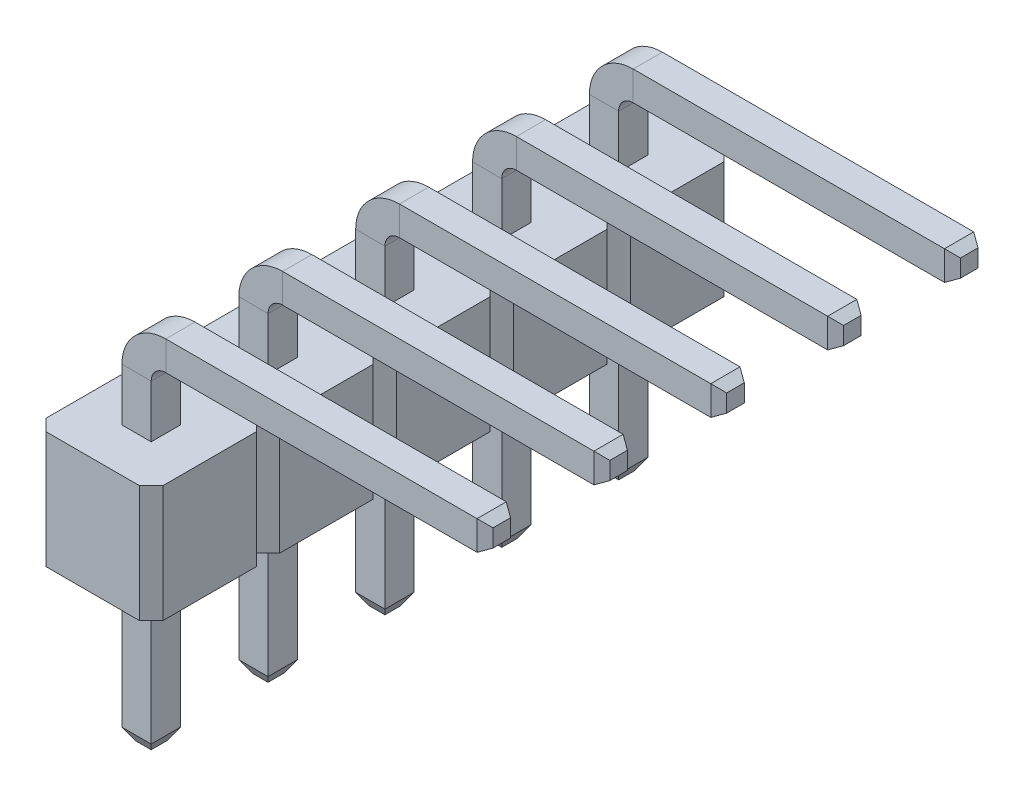
from build123d import *
from OCP.BRepFilletAPI import BRepFilletAPI_MakeChamfer

# Parameters (mm, degrees)
BOSS_EXTRUDE1_DEPTH          = 2.54
SKETCH3_W                    = 0.635
SKETCH3_H                    = 0.635
CHAMFER1_SIZE                = 0.254
CHAMFER1_SIZE2               = 0.146646968
CHAMFER2_SIZE                = 0.219970453
CHAMFER2_SIZE_2              = 0.127
LPATTERN1_COUNT              = 5
LPATTERN1_PITCH              = 2.54
CHAMFER1_OF_LPATTERN1_SIZE   = 0.254
CHAMFER1_OF_LPATTERN1_SIZE2  = 0.146646968
CHAMFER2_OF_LPATTERN1_SIZE   = 0.219970453
CHAMFER2_OF_LPATTERN1_SIZE_2 = 0.127


with BuildPart() as part:
    # Sketch1 → Boss-Extrude1 (new body)
    with BuildSketch(Plane(origin=(0, 0, 0), x_dir=(1, 0, 0), z_dir=(0, 1, 0))):
        Polygon((1.016, 1.27), (1.27, 1.016), (1.27, -1.016), (1.016, -1.27), (-1.016, -1.27), (-1.27, -1.016), (-1.27, 1.016), (-1.016, 1.27), align=None)
    boss_extrude1 = extrude(amount=BOSS_EXTRUDE1_DEPTH)

    # Sweep1: sweep along a path in Sketch2
    with BuildLine(Plane.XY) as sweep1_path:
        Line((0, -3.4036), (0, 0))
        Line((0, 0), (0, 3.683))
        ThreePointArc((0, 3.683), (0.185987194, 4.132012806), (0.635, 4.318))
        Line((0.635, 4.318), (7.62, 4.318))
    # Sketch3 → Sweep1 (sweep)
    with BuildSketch(Plane(origin=(0, -3.4036, 0), x_dir=(-1, 0, 0), z_dir=(0, -1, 0))):
        Rectangle(SKETCH3_W, SKETCH3_H)
    sweep1 = sweep(path=sweep1_path.line)

    # Chamfer1: one chamfer whose edges measure the first distance from different faces: ONE call of the kernel's chamfer builder (chamfer() names one face for all edges)
    chamfer1_edges_1 = [part.edges().sort_by_distance(p)[0] for p in [
        (0.3175, -3.4036, 0),
    ]]
    chamfer1_side_1 = [part.faces().sort_by_distance(p)[0] for p in [
        (0.3175, -1.7018, 0),
    ]]
    chamfer1_edges_2 = [part.edges().sort_by_distance(p)[0] for p in [
        (0, -3.4036, 0.3175),
    ]]
    chamfer1_side_2 = [part.faces().sort_by_distance(p)[0] for p in [
        (0, -1.7018, 0.3175),
    ]]
    chamfer1_edges_3 = [part.edges().sort_by_distance(p)[0] for p in [
        (-0.3175, -3.4036, 0),
    ]]
    chamfer1_side_3 = [part.faces().sort_by_distance(p)[0] for p in [
        (-0.3175, -1.7018, 0),
    ]]
    chamfer1_edges_4 = [part.edges().sort_by_distance(p)[0] for p in [
        (0, -3.4036, -0.3175),
    ]]
    chamfer1_side_4 = [part.faces().sort_by_distance(p)[0] for p in [
        (0, -1.7018, -0.3175),
    ]]
    chamfer1 = BRepFilletAPI_MakeChamfer(part.part.solid().wrapped)
    for e in chamfer1_edges_1:
        chamfer1.Add(CHAMFER1_SIZE, CHAMFER1_SIZE2, e.wrapped, chamfer1_side_1[0].wrapped)  # the first distance lies on this face
    for e in chamfer1_edges_2:
        chamfer1.Add(CHAMFER1_SIZE, CHAMFER1_SIZE2, e.wrapped, chamfer1_side_2[0].wrapped)  # the first distance lies on this face
    for e in chamfer1_edges_3:
        chamfer1.Add(CHAMFER1_SIZE, CHAMFER1_SIZE2, e.wrapped, chamfer1_side_3[0].wrapped)  # the first distance lies on this face
    for e in chamfer1_edges_4:
        chamfer1.Add(CHAMFER1_SIZE, CHAMFER1_SIZE2, e.wrapped, chamfer1_side_4[0].wrapped)  # the first distance lies on this face
    add(Compound.cast(chamfer1.Shape()), mode=Mode.REPLACE)

    # Chamfer2
    chamfer2_edges_1 = [part.edges().sort_by_distance(p)[0] for p in [
        (7.62, 4.0005, 0),
    ]]
    chamfer2_side_1 = [part.faces().sort_by_distance(p)[0] for p in [
        (7.61746, 4.0005, 0),
    ]]
    chamfer2_edges_2 = [part.edges().sort_by_distance(p)[0] for p in [
        (7.62, 4.318, 0.3175),
    ]]
    chamfer2_side_2 = [part.faces().sort_by_distance(p)[0] for p in [
        (7.61746, 4.318, 0.3175),
    ]]
    chamfer2_edges_3 = [part.edges().sort_by_distance(p)[0] for p in [
        (7.62, 4.6355, 0),
    ]]
    chamfer2_side_3 = [part.faces().sort_by_distance(p)[0] for p in [
        (7.62, 4.63296, 0),
    ]]
    chamfer2_edges_4 = [part.edges().sort_by_distance(p)[0] for p in [
        (7.62, 4.318, -0.3175),
    ]]
    chamfer2_side_4 = [part.faces().sort_by_distance(p)[0] for p in [
        (7.61746, 4.318, -0.3175),
    ]]
    chamfer2 = BRepFilletAPI_MakeChamfer(part.part.solid().wrapped)
    for e in chamfer2_edges_1:
        chamfer2.Add(CHAMFER2_SIZE - 0.0001, CHAMFER2_SIZE_2 - 0.0001, e.wrapped, chamfer2_side_1[0].wrapped)
    for e in chamfer2_edges_2:
        chamfer2.Add(CHAMFER2_SIZE - 0.0001, CHAMFER2_SIZE_2 - 0.0001, e.wrapped, chamfer2_side_2[0].wrapped)
    for e in chamfer2_edges_3:
        chamfer2.Add(CHAMFER2_SIZE_2 - 0.0001, CHAMFER2_SIZE - 0.0001, e.wrapped, chamfer2_side_3[0].wrapped)
    for e in chamfer2_edges_4:
        chamfer2.Add(CHAMFER2_SIZE - 0.0001, CHAMFER2_SIZE_2 - 0.0001, e.wrapped, chamfer2_side_4[0].wrapped)
    add(Compound.cast(chamfer2.Shape()), mode=Mode.REPLACE)  # a hair under: the kernel refuses the full size

    # LPattern1: Boss-Extrude1, Sweep1 ×5
    with Locations(*[(0, 0, i * LPATTERN1_PITCH) for i in range(1, LPATTERN1_COUNT)]):
        add(boss_extrude1)
        add(sweep1)

    # Chamfer1 of LPattern1: one chamfer whose edges measure the first distance from different faces: ONE call of the kernel's chamfer builder (chamfer() names one face for all edges)
    chamfer1_of_lpattern1_edges_1 = [part.edges().sort_by_distance(p)[0] for p in [
        (0.3175, -3.4036, 2.54),
    ]]
    chamfer1_of_lpattern1_side_1 = [part.faces().sort_by_distance(p)[0] for p in [
        (0.3175, -1.7018, 2.54),
    ]]
    chamfer1_of_lpattern1_edges_2 = [part.edges().sort_by_distance(p)[0] for p in [
        (0, -3.4036, 2.8575),
    ]]
    chamfer1_of_lpattern1_side_2 = [part.faces().sort_by_distance(p)[0] for p in [
        (0, -1.7018, 2.8575),
    ]]
    chamfer1_of_lpattern1_edges_3 = [part.edges().sort_by_distance(p)[0] for p in [
        (-0.3175, -3.4036, 2.54),
    ]]
    chamfer1_of_lpattern1_side_3 = [part.faces().sort_by_distance(p)[0] for p in [
        (-0.3175, -1.7018, 2.54),
    ]]
    chamfer1_of_lpattern1_edges_4 = [part.edges().sort_by_distance(p)[0] for p in [
        (0, -3.4036, 2.2225),
    ]]
    chamfer1_of_lpattern1_side_4 = [part.faces().sort_by_distance(p)[0] for p in [
        (0, -1.7018, 2.2225),
    ]]
    chamfer1_of_lpattern1_edges_5 = [part.edges().sort_by_distance(p)[0] for p in [
        (0.3175, -3.4036, 5.08),
    ]]
    chamfer1_of_lpattern1_side_5 = [part.faces().sort_by_distance(p)[0] for p in [
        (0.3175, -1.7018, 5.08),
    ]]
    chamfer1_of_lpattern1_edges_6 = [part.edges().sort_by_distance(p)[0] for p in [
        (0, -3.4036, 5.3975),
    ]]
    chamfer1_of_lpattern1_side_6 = [part.faces().sort_by_distance(p)[0] for p in [
        (0, -1.7018, 5.3975),
    ]]
    chamfer1_of_lpattern1_edges_7 = [part.edges().sort_by_distance(p)[0] for p in [
        (-0.3175, -3.4036, 5.08),
    ]]
    chamfer1_of_lpattern1_side_7 = [part.faces().sort_by_distance(p)[0] for p in [
        (-0.3175, -1.7018, 5.08),
    ]]
    chamfer1_of_lpattern1_edges_8 = [part.edges().sort_by_distance(p)[0] for p in [
        (0, -3.4036, 4.7625),
    ]]
    chamfer1_of_lpattern1_side_8 = [part.faces().sort_by_distance(p)[0] for p in [
        (0, -1.7018, 4.7625),
    ]]
    chamfer1_of_lpattern1_edges_9 = [part.edges().sort_by_distance(p)[0] for p in [
        (0.3175, -3.4036, 7.62),
    ]]
    chamfer1_of_lpattern1_side_9 = [part.faces().sort_by_distance(p)[0] for p in [
        (0.3175, -1.7018, 7.62),
    ]]
    chamfer1_of_lpattern1_edges_10 = [part.edges().sort_by_distance(p)[0] for p in [
        (0, -3.4036, 7.9375),
    ]]
    chamfer1_of_lpattern1_side_10 = [part.faces().sort_by_distance(p)[0] for p in [
        (0, -1.7018, 7.9375),
    ]]
    chamfer1_of_lpattern1_edges_11 = [part.edges().sort_by_distance(p)[0] for p in [
        (-0.3175, -3.4036, 7.62),
    ]]
    chamfer1_of_lpattern1_side_11 = [part.faces().sort_by_distance(p)[0] for p in [
        (-0.3175, -1.7018, 7.62),
    ]]
    chamfer1_of_lpattern1_edges_12 = [part.edges().sort_by_distance(p)[0] for p in [
        (0, -3.4036, 7.3025),
    ]]
    chamfer1_of_lpattern1_side_12 = [part.faces().sort_by_distance(p)[0] for p in [
        (0, -1.7018, 7.3025),
    ]]
    chamfer1_of_lpattern1_edges_13 = [part.edges().sort_by_distance(p)[0] for p in [
        (0.3175, -3.4036, 10.16),
    ]]
    chamfer1_of_lpattern1_side_13 = [part.faces().sort_by_distance(p)[0] for p in [
        (0.3175, -1.7018, 10.16),
    ]]
    chamfer1_of_lpattern1_edges_14 = [part.edges().sort_by_distance(p)[0] for p in [
        (0, -3.4036, 10.4775),
    ]]
    chamfer1_of_lpattern1_side_14 = [part.faces().sort_by_distance(p)[0] for p in [
        (0, -1.7018, 10.4775),
    ]]
    chamfer1_of_lpattern1_edges_15 = [part.edges().sort_by_distance(p)[0] for p in [
        (-0.3175, -3.4036, 10.16),
    ]]
    chamfer1_of_lpattern1_side_15 = [part.faces().sort_by_distance(p)[0] for p in [
        (-0.3175, -1.7018, 10.16),
    ]]
    chamfer1_of_lpattern1_edges_16 = [part.edges().sort_by_distance(p)[0] for p in [
        (0, -3.4036, 9.8425),
    ]]
    chamfer1_of_lpattern1_side_16 = [part.faces().sort_by_distance(p)[0] for p in [
        (0, -1.7018, 9.8425),
    ]]
    chamfer1_of_lpattern1 = BRepFilletAPI_MakeChamfer(part.part.solid().wrapped)
    for e in chamfer1_of_lpattern1_edges_1:
        chamfer1_of_lpattern1.Add(CHAMFER1_OF_LPATTERN1_SIZE, CHAMFER1_OF_LPATTERN1_SIZE2, e.wrapped, chamfer1_of_lpattern1_side_1[0].wrapped)  # the first distance lies on this face
    for e in chamfer1_of_lpattern1_edges_2:
        chamfer1_of_lpattern1.Add(CHAMFER1_OF_LPATTERN1_SIZE, CHAMFER1_OF_LPATTERN1_SIZE2, e.wrapped, chamfer1_of_lpattern1_side_2[0].wrapped)  # the first distance lies on this face
    for e in chamfer1_of_lpattern1_edges_3:
        chamfer1_of_lpattern1.Add(CHAMFER1_OF_LPATTERN1_SIZE, CHAMFER1_OF_LPATTERN1_SIZE2, e.wrapped, chamfer1_of_lpattern1_side_3[0].wrapped)  # the first distance lies on this face
    for e in chamfer1_of_lpattern1_edges_4:
        chamfer1_of_lpattern1.Add(CHAMFER1_OF_LPATTERN1_SIZE, CHAMFER1_OF_LPATTERN1_SIZE2, e.wrapped, chamfer1_of_lpattern1_side_4[0].wrapped)  # the first distance lies on this face
    for e in chamfer1_of_lpattern1_edges_5:
        chamfer1_of_lpattern1.Add(CHAMFER1_OF_LPATTERN1_SIZE, CHAMFER1_OF_LPATTERN1_SIZE2, e.wrapped, chamfer1_of_lpattern1_side_5[0].wrapped)  # the first distance lies on this face
    for e in chamfer1_of_lpattern1_edges_6:
        chamfer1_of_lpattern1.Add(CHAMFER1_OF_LPATTERN1_SIZE, CHAMFER1_OF_LPATTERN1_SIZE2, e.wrapped, chamfer1_of_lpattern1_side_6[0].wrapped)  # the first distance lies on this face
    for e in chamfer1_of_lpattern1_edges_7:
        chamfer1_of_lpattern1.Add(CHAMFER1_OF_LPATTERN1_SIZE, CHAMFER1_OF_LPATTERN1_SIZE2, e.wrapped, chamfer1_of_lpattern1_side_7[0].wrapped)  # the first distance lies on this face
    for e in chamfer1_of_lpattern1_edges_8:
        chamfer1_of_lpattern1.Add(CHAMFER1_OF_LPATTERN1_SIZE, CHAMFER1_OF_LPATTERN1_SIZE2, e.wrapped, chamfer1_of_lpattern1_side_8[0].wrapped)  # the first distance lies on this face
    for e in chamfer1_of_lpattern1_edges_9:
        chamfer1_of_lpattern1.Add(CHAMFER1_OF_LPATTERN1_SIZE, CHAMFER1_OF_LPATTERN1_SIZE2, e.wrapped, chamfer1_of_lpattern1_side_9[0].wrapped)  # the first distance lies on this face
    for e in chamfer1_of_lpattern1_edges_10:
        chamfer1_of_lpattern1.Add(CHAMFER1_OF_LPATTERN1_SIZE, CHAMFER1_OF_LPATTERN1_SIZE2, e.wrapped, chamfer1_of_lpattern1_side_10[0].wrapped)  # the first distance lies on this face
    for e in chamfer1_of_lpattern1_edges_11:
        chamfer1_of_lpattern1.Add(CHAMFER1_OF_LPATTERN1_SIZE, CHAMFER1_OF_LPATTERN1_SIZE2, e.wrapped, chamfer1_of_lpattern1_side_11[0].wrapped)  # the first distance lies on this face
    for e in chamfer1_of_lpattern1_edges_12:
        chamfer1_of_lpattern1.Add(CHAMFER1_OF_LPATTERN1_SIZE, CHAMFER1_OF_LPATTERN1_SIZE2, e.wrapped, chamfer1_of_lpattern1_side_12[0].wrapped)  # the first distance lies on this face
    for e in chamfer1_of_lpattern1_edges_13:
        chamfer1_of_lpattern1.Add(CHAMFER1_OF_LPATTERN1_SIZE, CHAMFER1_OF_LPATTERN1_SIZE2, e.wrapped, chamfer1_of_lpattern1_side_13[0].wrapped)  # the first distance lies on this face
    for e in chamfer1_of_lpattern1_edges_14:
        chamfer1_of_lpattern1.Add(CHAMFER1_OF_LPATTERN1_SIZE, CHAMFER1_OF_LPATTERN1_SIZE2, e.wrapped, chamfer1_of_lpattern1_side_14[0].wrapped)  # the first distance lies on this face
    for e in chamfer1_of_lpattern1_edges_15:
        chamfer1_of_lpattern1.Add(CHAMFER1_OF_LPATTERN1_SIZE, CHAMFER1_OF_LPATTERN1_SIZE2, e.wrapped, chamfer1_of_lpattern1_side_15[0].wrapped)  # the first distance lies on this face
    for e in chamfer1_of_lpattern1_edges_16:
        chamfer1_of_lpattern1.Add(CHAMFER1_OF_LPATTERN1_SIZE, CHAMFER1_OF_LPATTERN1_SIZE2, e.wrapped, chamfer1_of_lpattern1_side_16[0].wrapped)  # the first distance lies on this face
    add(Compound.cast(chamfer1_of_lpattern1.Shape()), mode=Mode.REPLACE)

    # Chamfer2 of LPattern1
    chamfer2_of_lpattern1_edges_1 = [part.edges().sort_by_distance(p)[0] for p in [
        (7.62, 4.0005, 2.54),
    ]]
    chamfer2_of_lpattern1_side_1 = [part.faces().sort_by_distance(p)[0] for p in [
        (7.61746, 4.0005, 2.54),
    ]]
    chamfer2_of_lpattern1_edges_2 = [part.edges().sort_by_distance(p)[0] for p in [
        (7.62, 4.318, 2.8575),
    ]]
    chamfer2_of_lpattern1_side_2 = [part.faces().sort_by_distance(p)[0] for p in [
        (7.61746, 4.318, 2.8575),
    ]]
    chamfer2_of_lpattern1_edges_3 = [part.edges().sort_by_distance(p)[0] for p in [
        (7.62, 4.6355, 2.54),
    ]]
    chamfer2_of_lpattern1_side_3 = [part.faces().sort_by_distance(p)[0] for p in [
        (7.62, 4.63296, 2.54),
    ]]
    chamfer2_of_lpattern1_edges_4 = [part.edges().sort_by_distance(p)[0] for p in [
        (7.62, 4.318, 2.2225),
    ]]
    chamfer2_of_lpattern1_side_4 = [part.faces().sort_by_distance(p)[0] for p in [
        (7.61746, 4.318, 2.2225),
    ]]
    chamfer2_of_lpattern1_edges_5 = [part.edges().sort_by_distance(p)[0] for p in [
        (7.62, 4.0005, 5.08),
    ]]
    chamfer2_of_lpattern1_side_5 = [part.faces().sort_by_distance(p)[0] for p in [
        (7.61746, 4.0005, 5.08),
    ]]
    chamfer2_of_lpattern1_edges_6 = [part.edges().sort_by_distance(p)[0] for p in [
        (7.62, 4.318, 5.3975),
    ]]
    chamfer2_of_lpattern1_side_6 = [part.faces().sort_by_distance(p)[0] for p in [
        (7.61746, 4.318, 5.3975),
    ]]
    chamfer2_of_lpattern1_edges_7 = [part.edges().sort_by_distance(p)[0] for p in [
        (7.62, 4.6355, 5.08),
    ]]
    chamfer2_of_lpattern1_side_7 = [part.faces().sort_by_distance(p)[0] for p in [
        (7.62, 4.63296, 5.08),
    ]]
    chamfer2_of_lpattern1_edges_8 = [part.edges().sort_by_distance(p)[0] for p in [
        (7.62, 4.318, 4.7625),
    ]]
    chamfer2_of_lpattern1_side_8 = [part.faces().sort_by_distance(p)[0] for p in [
        (7.61746, 4.318, 4.7625),
    ]]
    chamfer2_of_lpattern1_edges_9 = [part.edges().sort_by_distance(p)[0] for p in [
        (7.62, 4.0005, 7.62),
    ]]
    chamfer2_of_lpattern1_side_9 = [part.faces().sort_by_distance(p)[0] for p in [
        (7.61746, 4.0005, 7.62),
    ]]
    chamfer2_of_lpattern1_edges_10 = [part.edges().sort_by_distance(p)[0] for p in [
        (7.62, 4.318, 7.9375),
    ]]
    chamfer2_of_lpattern1_side_10 = [part.faces().sort_by_distance(p)[0] for p in [
        (7.61746, 4.318, 7.9375),
    ]]
    chamfer2_of_lpattern1_edges_11 = [part.edges().sort_by_distance(p)[0] for p in [
        (7.62, 4.6355, 7.62),
    ]]
    chamfer2_of_lpattern1_side_11 = [part.faces().sort_by_distance(p)[0] for p in [
        (7.62, 4.63296, 7.62),
    ]]
    chamfer2_of_lpattern1_edges_12 = [part.edges().sort_by_distance(p)[0] for p in [
        (7.62, 4.318, 7.3025),
    ]]
    chamfer2_of_lpattern1_side_12 = [part.faces().sort_by_distance(p)[0] for p in [
        (7.61746, 4.318, 7.3025),
    ]]
    chamfer2_of_lpattern1_edges_13 = [part.edges().sort_by_distance(p)[0] for p in [
        (7.62, 4.0005, 10.16),
    ]]
    chamfer2_of_lpattern1_side_13 = [part.faces().sort_by_distance(p)[0] for p in [
        (7.61746, 4.0005, 10.16),
    ]]
    chamfer2_of_lpattern1_edges_14 = [part.edges().sort_by_distance(p)[0] for p in [
        (7.62, 4.318, 10.4775),
    ]]
    chamfer2_of_lpattern1_side_14 = [part.faces().sort_by_distance(p)[0] for p in [
        (7.61746, 4.318, 10.4775),
    ]]
    chamfer2_of_lpattern1_edges_15 = [part.edges().sort_by_distance(p)[0] for p in [
        (7.62, 4.6355, 10.16),
    ]]
    chamfer2_of_lpattern1_side_15 = [part.faces().sort_by_distance(p)[0] for p in [
        (7.62, 4.63296, 10.16),
    ]]
    chamfer2_of_lpattern1_edges_16 = [part.edges().sort_by_distance(p)[0] for p in [
        (7.62, 4.318, 9.8425),
    ]]
    chamfer2_of_lpattern1_side_16 = [part.faces().sort_by_distance(p)[0] for p in [
        (7.61746, 4.318, 9.8425),
    ]]
    chamfer2_of_lpattern1 = BRepFilletAPI_MakeChamfer(part.part.solid().wrapped)
    for e in chamfer2_of_lpattern1_edges_1:
        chamfer2_of_lpattern1.Add(CHAMFER2_OF_LPATTERN1_SIZE - 0.0001, CHAMFER2_OF_LPATTERN1_SIZE_2 - 0.0001, e.wrapped, chamfer2_of_lpattern1_side_1[0].wrapped)
    for e in chamfer2_of_lpattern1_edges_2:
        chamfer2_of_lpattern1.Add(CHAMFER2_OF_LPATTERN1_SIZE - 0.0001, CHAMFER2_OF_LPATTERN1_SIZE_2 - 0.0001, e.wrapped, chamfer2_of_lpattern1_side_2[0].wrapped)
    for e in chamfer2_of_lpattern1_edges_3:
        chamfer2_of_lpattern1.Add(CHAMFER2_OF_LPATTERN1_SIZE_2 - 0.0001, CHAMFER2_OF_LPATTERN1_SIZE - 0.0001, e.wrapped, chamfer2_of_lpattern1_side_3[0].wrapped)
    for e in chamfer2_of_lpattern1_edges_4:
        chamfer2_of_lpattern1.Add(CHAMFER2_OF_LPATTERN1_SIZE - 0.0001, CHAMFER2_OF_LPATTERN1_SIZE_2 - 0.0001, e.wrapped, chamfer2_of_lpattern1_side_4[0].wrapped)
    for e in chamfer2_of_lpattern1_edges_5:
        chamfer2_of_lpattern1.Add(CHAMFER2_OF_LPATTERN1_SIZE - 0.0001, CHAMFER2_OF_LPATTERN1_SIZE_2 - 0.0001, e.wrapped, chamfer2_of_lpattern1_side_5[0].wrapped)
    for e in chamfer2_of_lpattern1_edges_6:
        chamfer2_of_lpattern1.Add(CHAMFER2_OF_LPATTERN1_SIZE - 0.0001, CHAMFER2_OF_LPATTERN1_SIZE_2 - 0.0001, e.wrapped, chamfer2_of_lpattern1_side_6[0].wrapped)
    for e in chamfer2_of_lpattern1_edges_7:
        chamfer2_of_lpattern1.Add(CHAMFER2_OF_LPATTERN1_SIZE_2 - 0.0001, CHAMFER2_OF_LPATTERN1_SIZE - 0.0001, e.wrapped, chamfer2_of_lpattern1_side_7[0].wrapped)
    for e in chamfer2_of_lpattern1_edges_8:
        chamfer2_of_lpattern1.Add(CHAMFER2_OF_LPATTERN1_SIZE - 0.0001, CHAMFER2_OF_LPATTERN1_SIZE_2 - 0.0001, e.wrapped, chamfer2_of_lpattern1_side_8[0].wrapped)
    for e in chamfer2_of_lpattern1_edges_9:
        chamfer2_of_lpattern1.Add(CHAMFER2_OF_LPATTERN1_SIZE - 0.0001, CHAMFER2_OF_LPATTERN1_SIZE_2 - 0.0001, e.wrapped, chamfer2_of_lpattern1_side_9[0].wrapped)
    for e in chamfer2_of_lpattern1_edges_10:
        chamfer2_of_lpattern1.Add(CHAMFER2_OF_LPATTERN1_SIZE - 0.0001, CHAMFER2_OF_LPATTERN1_SIZE_2 - 0.0001, e.wrapped, chamfer2_of_lpattern1_side_10[0].wrapped)
    for e in chamfer2_of_lpattern1_edges_11:
        chamfer2_of_lpattern1.Add(CHAMFER2_OF_LPATTERN1_SIZE_2 - 0.0001, CHAMFER2_OF_LPATTERN1_SIZE - 0.0001, e.wrapped, chamfer2_of_lpattern1_side_11[0].wrapped)
    for e in chamfer2_of_lpattern1_edges_12:
        chamfer2_of_lpattern1.Add(CHAMFER2_OF_LPATTERN1_SIZE - 0.0001, CHAMFER2_OF_LPATTERN1_SIZE_2 - 0.0001, e.wrapped, chamfer2_of_lpattern1_side_12[0].wrapped)
    for e in chamfer2_of_lpattern1_edges_13:
        chamfer2_of_lpattern1.Add(CHAMFER2_OF_LPATTERN1_SIZE - 0.0001, CHAMFER2_OF_LPATTERN1_SIZE_2 - 0.0001, e.wrapped, chamfer2_of_lpattern1_side_13[0].wrapped)
    for e in chamfer2_of_lpattern1_edges_14:
        chamfer2_of_lpattern1.Add(CHAMFER2_OF_LPATTERN1_SIZE - 0.0001, CHAMFER2_OF_LPATTERN1_SIZE_2 - 0.0001, e.wrapped, chamfer2_of_lpattern1_side_14[0].wrapped)
    for e in chamfer2_of_lpattern1_edges_15:
        chamfer2_of_lpattern1.Add(CHAMFER2_OF_LPATTERN1_SIZE_2 - 0.0001, CHAMFER2_OF_LPATTERN1_SIZE - 0.0001, e.wrapped, chamfer2_of_lpattern1_side_15[0].wrapped)
    for e in chamfer2_of_lpattern1_edges_16:
        chamfer2_of_lpattern1.Add(CHAMFER2_OF_LPATTERN1_SIZE - 0.0001, CHAMFER2_OF_LPATTERN1_SIZE_2 - 0.0001, e.wrapped, chamfer2_of_lpattern1_side_16[0].wrapped)
    add(Compound.cast(chamfer2_of_lpattern1.Shape()), mode=Mode.REPLACE)  # a hair under: the kernel refuses the full size


solid = part.part
